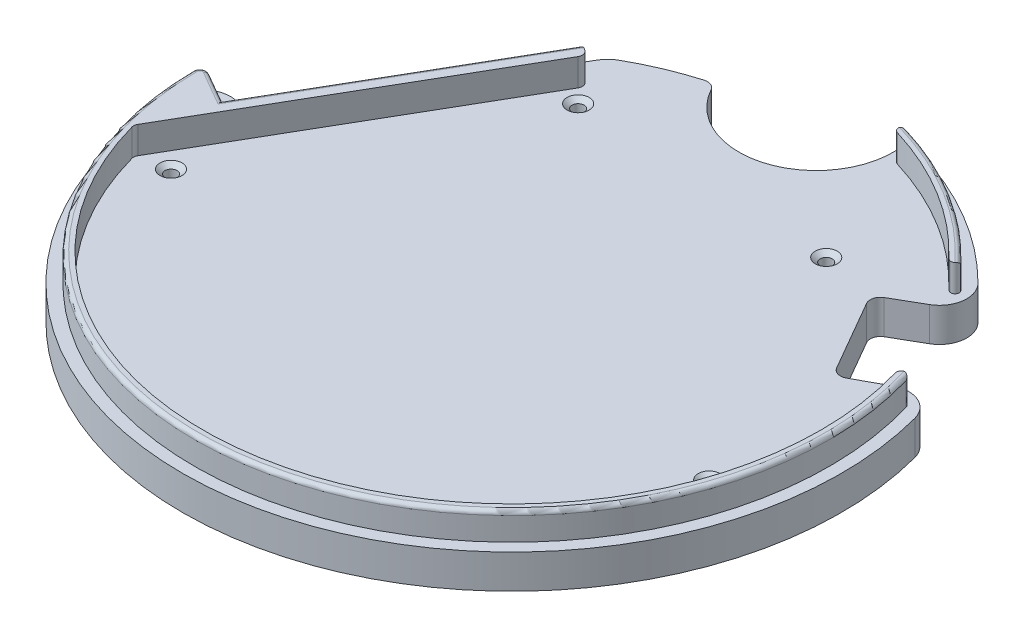
from build123d import *

# Parameters (mm, degrees)
BOSS_EXTRUDE1_DEPTH             = 6.35
BOSS_EXTRUDE6_DEPTH             = 5.08
FILLET14_R                      = 5.08
FILLET16_R                      = 1.905
FILLET17_R                      = 1.27
FILLET18_R                      = 0.762
F_4_40_TAPPED_HOLE2_D           = 2.2606
F_4_40_TAPPED_HOLE2_CSINK_D     = 4.1148
F_4_40_TAPPED_HOLE2_CSINK_ANGLE = 100


with BuildPart() as part:
    # Sketch1 → Boss-Extrude1 (new body)
    with BuildSketch(Plane(origin=(0, 0, 0), x_dir=(1, 0, 0), z_dir=(0, 1, 0))):
        with BuildLine():
            Line((-32.253592819, 37.099138511), (-40.254592819, 23.241))
            Line((-40.254592819, 23.241), (-52.351555238, 2.288446473))
            Line((-52.351555238, 2.288446473), (-61.152528051, 7.369690496))
            ThreePointArc((-61.152528051, 7.369690496), (7.45083255, -61.142694734), (57.593043611, 21.839994338))
            Line((57.593043611, 21.839994338), (45.017092819, 14.992108029))
            Line((45.017092819, 14.992108029), (35.492092819, 31.489891971))
            Line((35.492092819, 31.489891971), (47.93867456, 38.67592929))
            ThreePointArc((47.93867456, 38.67592929), (32.807858132, 52.130494624), (14.131882123, 59.951930183))
            ThreePointArc((14.131882123, 59.951930183), (4.380709214, 43.075056101), (-13.323695155, 51.227866526))
            ThreePointArc((-13.323695155, 51.227866526), (-20.56358212, 48.774524619), (-27.374593602, 45.30393787))
            Line((-27.374593602, 45.30393787), (-32.253592819, 37.099138511))
        make_face()
    extrude(amount=BOSS_EXTRUDE1_DEPTH)

    # Sketch11 → Boss-Extrude6 (add)
    with BuildSketch(Plane(origin=(0, 6.35, 0), x_dir=(1, 0, 0), z_dir=(0, 1, 0))):
        with BuildLine():
            Line((-51.642474306, -2.520350645), (-59.315900126, 1.909903818))
            ThreePointArc((-59.315900126, 1.909903818), (8.075233998, -58.794679489), (56.604538416, 17.831151702))
            Line((56.604538416, 17.831151702), (55.18302034, 17.057103335))
            ThreePointArc((55.18302034, 17.057103335), (15.941309212, -55.515629949), (-55.825680829, -14.819037351))
            Line((-55.825680829, -14.819037351), (-24.769862567, 38.840617327))
            Line((-24.769862567, 38.840617327), (-26.96822824, 40.112933469))
            Line((-26.96822824, 40.112933469), (-51.642474306, -2.520350645))
        make_face()
        with BuildLine():
            Line((42.534833803, 39.075547615), (43.942550941, 39.888293484))
            ThreePointArc((43.942550941, 39.888293484), (31.224480147, 50.468362167), (16.080037332, 57.1266675))
            Line((16.080037332, 57.1266675), (15.64988416, 55.598485895))
            ThreePointArc((15.64988416, 55.598485895), (30.242639161, 49.208670827), (42.534833803, 39.075547615))
        make_face()
    extrude(amount=BOSS_EXTRUDE6_DEPTH)

    # Fillet14
    fillet14_edges = [part.edges().sort_by_distance(p)[0] for p in [
        (47.93867456, 3.175, -38.67592929),
        (57.593043611, 3.175, -21.839994338),
        (-61.152528051, 3.175, -7.369690496),
        (-27.374593602, 3.175, -45.30393787),
    ]]
    fillet(fillet14_edges, radius=FILLET14_R)

    # Fillet16
    fillet16_edges = [part.edges().sort_by_distance(p)[0] for p in [
        (45.017092819, 3.175, -14.992108029),
        (35.492092819, 3.175, -31.489891971),
        (-13.323695155, 3.175, -51.227866526),
        (14.131882123, 3.175, -59.951930183),
        (-32.253592819, 3.175, -37.099138511),
        (-52.351555238, 3.175, -2.288446473),
    ]]
    fillet(fillet16_edges, radius=FILLET16_R)

    # Fillet17
    fillet17_edges = [part.edges().sort_by_distance(p)[0] for p in [
        (-24.769862567, 8.89, -38.840617327),
        (-59.315900126, 8.89, -1.909903818),
        (55.18302034, 8.89, -17.057103335),
        (-55.825680829, 8.89, 14.819037351),
        (15.64988416, 8.89, -55.598485895),
        (42.534833803, 8.89, -39.075547615),
    ]]
    fillet(fillet17_edges, radius=FILLET17_R)

    # Fillet18
    # the kernel refuses this fillet: 0.762 mm, written as the material it takes off along each edge
    with BuildSketch(Plane(origin=(56.604538416, 6.35, -17.831151702), x_dir=(0.2914560828028139, 0, 0.9565842105101043), z_dir=(0, 1, 0))) as fillet18_piece_1:
        with BuildLine():
            CenterArc((1.111341465, -0.761966165), FILLET18_R, 89.460057438, 150.909144636)
            Line((0.734601677, -1.424318889), (0.696927698, -1.490554162))
            ThreePointArc((0.696927698, -1.490554162), (0.043911241, -0.591644128), (-0.074637174, -0.015353572))
            Line((-0.074637174, -0.015353572), (-0.000718081, 0.076196616))
            ThreePointArc((-0.000718081, 0.076196616), (0.559261138, 0.078835195), (1.119240357, 0.076196616))
            Line((1.119240357, 0.076196616), (1.118522276, 0))
        make_face()
    extrude(amount=9.086497787, mode=Mode.SUBTRACT)
    with BuildSketch(Plane(origin=(43.942550941, 6.35, -39.888293484), x_dir=(-0.9654520894435082, 0, 0.2605806266574016), z_dir=(0, 1, 0))) as fillet18_piece_2:
        with BuildLine():
            CenterArc((1.196678226, -0.641298996), FILLET18_R, 57.309434955, 150.909144636)
            Line((0.525241797, -1.001600428), (0.458098154, -1.037630571))
            ThreePointArc((0.458098154, -1.037630571), (0.192751008, -0.537440161), (-0.067818044, -0.034744107))
            Line((-0.067818044, -0.034744107), (-0.019587713, 0.073639402))
            ThreePointArc((-0.019587713, 0.073639402), (0.576256944, 0.232131105), (1.649391505, 0.0641299))
            Line((1.649391505, 0.0641299), (1.608235753, 0))
        make_face()
    extrude(amount=9.100589381, mode=Mode.SUBTRACT)
    with BuildSketch(Plane(origin=(-26.96822824, 6.35, -40.112933469), x_dir=(-0.5009118669957486, 0, 0.8654982966492963), z_dir=(0, 1, 0))) as fillet18_piece_3:
        with BuildLine():
            CenterArc((FILLET18_R, FILLET18_R), FILLET18_R, 180, 90)
            Line((0, FILLET18_R), (0, 0))
            Line((0, 0), (FILLET18_R, 0))
        make_face()
    extrude(amount=6.985, mode=Mode.SUBTRACT)
    with BuildSketch(Plane(origin=(16.080037332, 6.35, -57.1266675), x_dir=(0.960208894047144, 0, 0.2792827953755126), z_dir=(0, 1, 0))) as fillet18_piece_4:
        with BuildLine():
            CenterArc((1.021997529, -0.761971386), FILLET18_R, 89.503466107, 150.909144636)
            Line((0.645759664, -1.424609348), (0.608135877, -1.490873144))
            ThreePointArc((0.608135877, -1.490873144), (-0.073326676, -0.331878972), (-0.076197139, -0.000660352))
            Line((-0.076197139, -0.000660352), (-0.000660352, 0.076197139))
            ThreePointArc((-0.000660352, 0.076197139), (0.514300527, 0.078428517), (1.029261406, 0.076197139))
            Line((1.029261406, 0.076197139), (1.028601054, 0))
        make_face()
    extrude(amount=8.990336733, mode=Mode.SUBTRACT)
    with BuildSketch(Plane(origin=(-49.992695912, 11.43, 3.472850645), x_dir=(0, -1, 0), z_dir=(-0.8660254037844384, 0, -0.5000000000000006))) as fillet18_piece_5_section:
        with BuildLine():
            CenterArc((FILLET18_R, FILLET18_R), FILLET18_R, 180, 90)
            Line((0, FILLET18_R), (0, 0))
            Line((0, 0), (FILLET18_R, 0))
        make_face()
    fillet18_piece_5 = extrude(amount=8.600562568, mode=Mode.PRIVATE)
    fillet18_piece_5 = split(fillet18_piece_5, bisect_by=Plane(origin=(-51.641469253, 11.43, 2.518614067), z_dir=(-0.8654982966492973, 0, -0.5009118669957471)), keep=Keep.TOP, mode=Mode.PRIVATE)
    add(fillet18_piece_5, mode=Mode.SUBTRACT)
    with BuildSketch(Plane(origin=(-58.076001583, 11.43, 0.272421623), x_dir=(0.49999999999999845, 0, -0.8660254037844397), z_dir=(0.8660254037844397, 0, 0.49999999999999845))) as fillet18_piece_6:
        with BuildLine():
            CenterArc((1.27 - FILLET18_R, -FILLET18_R), FILLET18_R, 0, 90)
            Line((1.27 - FILLET18_R, 0), (1.27, 0))
            Line((1.27, 0), (1.27, -FILLET18_R))
        make_face()
    revolve(axis=Axis((-58.076001583, 11.43, 0.272421623), (0, 1, 0)), revolution_arc=120.268759804, mode=Mode.SUBTRACT)
    with BuildSketch(Plane(origin=(-26.013991134, 11.43, -41.761707724), x_dir=(0, -1, 0), z_dir=(-0.5009118669957471, 0, 0.8654982966492973))) as fillet18_piece_7_section:
        with BuildLine():
            CenterArc((FILLET18_R, FILLET18_R), FILLET18_R, 180, 90)
            Line((0, FILLET18_R), (0, 0))
            Line((0, 0), (FILLET18_R, 0))
        make_face()
    fillet18_piece_7 = extrude(amount=53.068657444, mode=Mode.PRIVATE)
    fillet18_piece_7 = split(fillet18_piece_7, bisect_by=Plane(origin=(-51.595805666, 11.43, 2.547294796), z_dir=(0.5000000000000006, 0, -0.8660254037844384)), keep=Keep.TOP, mode=Mode.PRIVATE)
    add(fillet18_piece_7, mode=Mode.SUBTRACT)
    with BuildSketch(Plane(origin=(0, 11.43, 0), x_dir=(0.761629515590845, 0, -0.6480127166814359), z_dir=(0.6480127166814359, 0, 0.761629515590845))) as fillet18_piece_8:
        with BuildLine():
            CenterArc((59.346640514 - FILLET18_R, -FILLET18_R), FILLET18_R, 0, 90)
            Line((59.346640514 - FILLET18_R, 0), (59.346640514, 0))
            Line((59.346640514, 0), (59.346640514, -FILLET18_R))
        make_face()
    revolve(axis=Axis((0, 11.43, 0), (0, 1, 0)), revolution_arc=35.726455219, mode=Mode.SUBTRACT)
    with BuildSketch(Plane(origin=(0, 11.43, 0), x_dir=(-0.9999889984830188, 0, 0.004690726268822115), z_dir=(-0.004690726268822115, 0, -0.9999889984830188))) as fillet18_piece_9:
        with BuildLine():
            CenterArc((59.346640514 - FILLET18_R, -FILLET18_R), FILLET18_R, 0, 90)
            Line((59.346640514 - FILLET18_R, 0), (59.346640514, 0))
            Line((59.346640514, 0), (59.346640514, -FILLET18_R))
        make_face()
    revolve(axis=Axis((0, 11.43, 0), (0, 1, 0)), revolution_arc=199.059052139, mode=Mode.SUBTRACT)
    with BuildSketch(Plane(origin=(-49.992695912, 11.43, 3.472850645), x_dir=(0, -1, 0), z_dir=(-0.8660254037844384, 0, -0.5000000000000006))) as fillet18_piece_10a_section:
        with BuildLine():
            CenterArc((FILLET18_R, FILLET18_R), FILLET18_R, 180, 90)
            Line((0, FILLET18_R), (0, 0))
            Line((0, 0), (FILLET18_R, 0))
        make_face()
    fillet18_piece_10a = extrude(amount=8.600562568, mode=Mode.PRIVATE)
    fillet18_piece_10a = split(fillet18_piece_10a, bisect_by=Plane(origin=(-51.641469253, 11.43, 2.518614067), z_dir=(0.8654982966492973, 0, 0.5009118669957471)), keep=Keep.TOP, mode=Mode.PRIVATE)
    with BuildSketch(Plane(origin=(-26.013991134, 11.43, -41.761707724), x_dir=(0, -1, 0), z_dir=(-0.5009118669957471, 0, 0.8654982966492973))) as fillet18_piece_10b_section:
        with BuildLine():
            CenterArc((FILLET18_R, FILLET18_R), FILLET18_R, 180, 90)
            Line((0, FILLET18_R), (0, 0))
            Line((0, 0), (FILLET18_R, 0))
        make_face()
    fillet18_piece_10b = extrude(amount=53.068657444, mode=Mode.PRIVATE)
    fillet18_piece_10b = split(fillet18_piece_10b, bisect_by=Plane(origin=(-51.595805666, 11.43, 2.547294796), z_dir=(-0.5000000000000006, 0, 0.8660254037844384)), keep=Keep.TOP, mode=Mode.PRIVATE)
    fillet18_piece_10 = fillet18_piece_10a & fillet18_piece_10b
    add(fillet18_piece_10, mode=Mode.SUBTRACT)

    # #4-40 Tapped Hole2 (through all)
    with Locations(Plane(origin=(0, 6.35, 0), x_dir=(1, 0, 0), z_dir=(0, 1, 0))):
        with Locations((-22.830825604, 35.196661052), (-50.276937356, -13.438454396), (50.307612814, -13.438454396), (25.237025094, 33.505861406)):
            CounterSinkHole(F_4_40_TAPPED_HOLE2_D / 2, F_4_40_TAPPED_HOLE2_CSINK_D / 2, counter_sink_angle=F_4_40_TAPPED_HOLE2_CSINK_ANGLE)


solid = part.part
